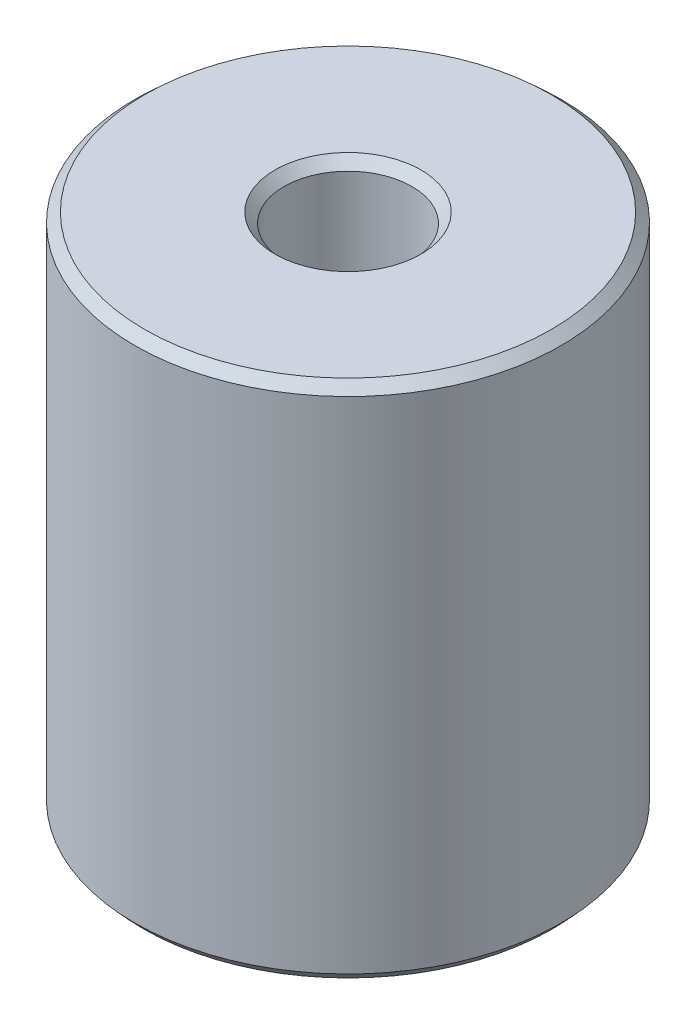
from build123d import *
from OCP.BRepFilletAPI import BRepFilletAPI_MakeChamfer

# Parameters (mm, degrees)
SKETCH1_R           = 5
BOSS_EXTRUDE1_DEPTH = 12.16989926
SKETCH2_R           = 1.500400945
CUT_EXTRUDE1_DEPTH  = 15.075029236
CHAMFER1_SIZE       = 0.211939482
CHAMFER1_SIZE2      = 0.230903096


with BuildPart() as part:
    # Sketch1 → Boss-Extrude1 (new body)
    with BuildSketch(Plane(origin=(0, 0, 0), x_dir=(1, 0, 0), z_dir=(0, 1, 0))):
        Circle(SKETCH1_R)
    extrude(amount=BOSS_EXTRUDE1_DEPTH)

    # Sketch2 → Cut-Extrude1 (cut, through all)
    with BuildSketch(Plane(origin=(0, 0, 0), x_dir=(1, 0, 0), z_dir=(0, 1, 0))):
        Circle(SKETCH2_R)
    extrude(amount=CUT_EXTRUDE1_DEPTH, mode=Mode.SUBTRACT)

    # Chamfer1: one chamfer whose edges measure the first distance from different faces: ONE call of the kernel's chamfer builder (chamfer() names one face for all edges)
    chamfer1_edges_1 = [part.edges().sort_by_distance(p)[0] for p in [
        (-1.500400945, 12.16989926, 0),
    ]]
    chamfer1_side_1 = [part.faces().sort_by_distance(p)[0] for p in [
        (-4.858578644, 12.16989926, 0),
    ]]
    chamfer1_edges_2 = [part.edges().sort_by_distance(p)[0] for p in [
        (-1.500400945, 0, 0),
    ]]
    chamfer1_side_2 = [part.faces().sort_by_distance(p)[0] for p in [
        (-1.500400945, 6.08494963, 0),
    ]]
    chamfer1_edges_3 = [part.edges().sort_by_distance(p)[0] for p in [
        (-5, 0, 0),
    ]]
    chamfer1_side_3 = [part.faces().sort_by_distance(p)[0] for p in [
        (-4.858578644, 0, 0),
    ]]
    chamfer1_edges_4 = [part.edges().sort_by_distance(p)[0] for p in [
        (-5, 12.16989926, 0),
    ]]
    chamfer1_side_4 = [part.faces().sort_by_distance(p)[0] for p in [
        (-5, 6.08494963, 0),
    ]]
    chamfer1 = BRepFilletAPI_MakeChamfer(part.part.solid().wrapped)
    for e in chamfer1_edges_1:
        chamfer1.Add(CHAMFER1_SIZE, CHAMFER1_SIZE2, e.wrapped, chamfer1_side_1[0].wrapped)  # the first distance lies on this face
    for e in chamfer1_edges_2:
        chamfer1.Add(CHAMFER1_SIZE, CHAMFER1_SIZE2, e.wrapped, chamfer1_side_2[0].wrapped)  # the first distance lies on this face
    for e in chamfer1_edges_3:
        chamfer1.Add(CHAMFER1_SIZE, CHAMFER1_SIZE2, e.wrapped, chamfer1_side_3[0].wrapped)  # the first distance lies on this face
    for e in chamfer1_edges_4:
        chamfer1.Add(CHAMFER1_SIZE, CHAMFER1_SIZE2, e.wrapped, chamfer1_side_4[0].wrapped)  # the first distance lies on this face
    add(Compound.cast(chamfer1.Shape()), mode=Mode.REPLACE)


solid = part.part
